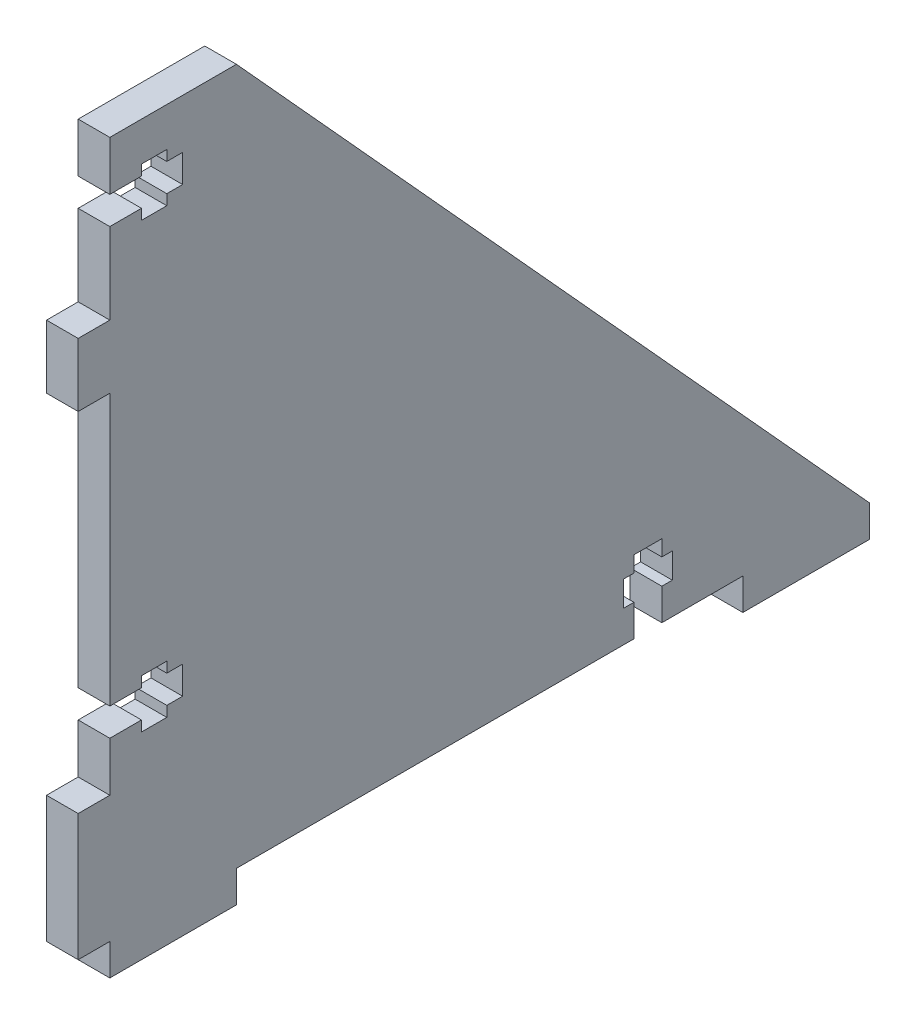
from build123d import *

# Parameters (mm, degrees)
BOSS_EXTRUDE1_DEPTH = 5


with BuildPart() as part:
    # Sketch1 → Boss-Extrude1 (new body)
    with BuildSketch(Plane(origin=(0, 0, 0), x_dir=(0, 0, -1), z_dir=(1, 0, 0))):
        Polygon((120, 0), (20, 110), (0, 110), (0, 102.2), (5, 102.2), (5, 103.85), (9, 103.85), (9, 102.2), (11.5, 102.2), (11.5, 97.8), (9, 97.8), (9, 96.15), (5, 96.15), (5, 97.8), (0, 97.8), (0, 85), (-5, 85), (-5, 75), (0, 75), (0, 32.2), (5, 32.2), (5, 33.85), (9, 33.85), (9, 32.2), (11.5, 32.2), (11.5, 27.8), (9, 27.8), (9, 26.15), (5, 26.15), (5, 27.8), (0, 27.8), (0, 20), (-5, 20), (-5, 0), (0, 0), (0, -5), (20, -5), (20, 0), (82.8, 0), (82.8, 5), (81.15, 5), (81.15, 9), (82.8, 9), (82.8, 11.5), (87.2, 11.5), (87.2, 9), (88.85, 9), (88.85, 5), (87.2, 5), (87.2, 0), (100, 0), (100, -5), (120, -5), align=None)
    extrude(amount=BOSS_EXTRUDE1_DEPTH)


solid = part.part
